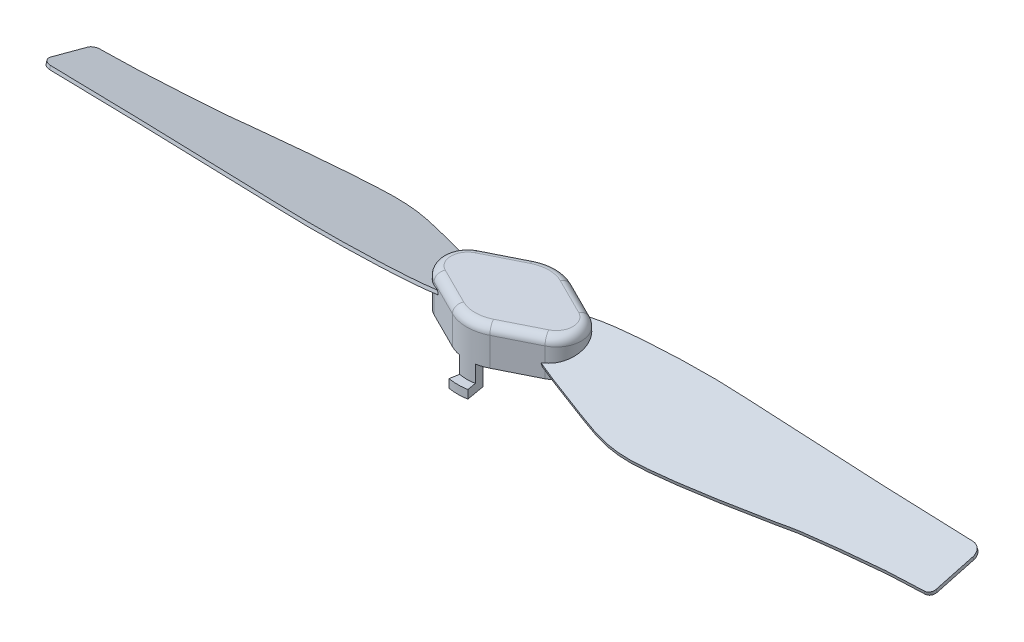
from build123d import *

# Parameters (mm, degrees)
EXTRUDE_START            = 2
EXTRUDE_1_DEPTH          = 3.2
EXTRUDE_3_DEPTH          = 0.1
PATTERN_CIRCULAR_1_COUNT = 2
SCALE_1_SCALE            = 2
FILLET_4_R               = 3
FILLET_5_R               = 5
FILLET_6_R               = 1
CUT_EXTRUDE_START        = -2
CUT_EXTRUDE_2_DEPTH      = 2
EXTRUDE_4_DEPTH          = 1
SCALE_2_SCALE            = 1.2
SKETCH_11_R              = 1
CUT_EXTRUDE_1_DEPTH      = 10


with BuildPart() as part:
    # 草图1 → 凸台-拉伸1 (new body)
    with BuildSketch(Plane(origin=(0, 0, 0), x_dir=(1, 0, 0), z_dir=(0, 1, 0)).offset(EXTRUDE_START)):
        Polygon((0, 2.9999999999999987), (-6, -8.7e-16), (0, -3.0000000000000013), (6, -8.7e-16), align=None)
    extrude(amount=EXTRUDE_1_DEPTH)

    # 草图9 → 凸台-拉伸3 (add, symmetric)
    with BuildSketch(Plane(origin=(0, 3.797877056362574, 1.0176380902050437), x_dir=(1, 0, 0), z_dir=(0, -0.9659258262890681, -0.25881904510252135))):
        with BuildLine():
            Line((-26.704099966580973, 0.3228041612460983), (-26.704099966580973, -1.9456761450061155))
            ThreePointArc((-26.704099966580973, -1.9456761450061155), (-26.533870316829233, -2.3867624553547033), (-26.111452674601363, -2.5991267705448466))
            add(Edge.make_bspline(
                [(-26.111452674601363, -2.5991267705448466), (-22.91052955721552, -2.689038243060296), (-24.11600085649285, -2.647838483964524), (-17.55233762123022, -2.8675340095287067), (-13.329663826254631, -3.0646436883019175), (-9.295103789130488, -3.2316401812276747), (-3.3382956120395084, -3.0618584532998), (-1.3944307323966896, -1.9667682940381868), (2.5093571682922495, 0.10610292246982139), (-1.4328853293939272, -0.5176380902050427)],
                knots=[0, 0, 0, 0, 0.21391373935722907, 0.26957603752511283, 0.5247288767728682, 0.5822784270431667, 0.7875219899577989, 0.8184556881986614, 1, 1, 1, 1], degree=3))
            add(Edge.make_bspline(
                [(-1.4328853293939272, -0.5176380902050427), (-2.7254157371995125, 0.27488564280840305), (-2.9583478396869727, 0.3643261996773897), (-7.694909114548022, 1.9383194941570494), (-9.152331340020703, 2.4326101573356893), (-12.990392513685167, 2.1706227424022266), (-15.907183554042758, 1.747793942402001), (-19.098378261811416, 1.2660471225422296), (-18.80374303384359, 1.197314804012044), (-24.763605801949996, 0.7054991365312095), (-25.80195775381894, 0.7263718807801985), (-26.339263844723146, 0.6876014087170593)],
                knots=[0, 0, 0, 0, 0.27318993124150337, 0.32414467973247946, 0.4889471732233965, 0.5311525810637701, 0.7039933502958418, 0.7485062511039996, 0.9317686883371911, 0.9592088436922059, 1, 1, 1, 1], degree=3))
            ThreePointArc((-26.339263844723146, 0.6876014087170593), (-26.597239582143125, 0.5807685132284266), (-26.704099966580973, 0.3228041612460983))
        make_face()
    extrude(amount=EXTRUDE_3_DEPTH, both=True)

    # 阵列(圆周)1: part ×2 about axis
    pattern_circular_1_axis = Axis((0, 4.339942807531289, 0), (0, -1, 0))


with BuildPart() as part_1:
    add(part.part)
    for i in range(1, PATTERN_CIRCULAR_1_COUNT):
        add(part.part.rotate(pattern_circular_1_axis, i * 360 / PATTERN_CIRCULAR_1_COUNT))


with BuildPart() as part_2:
    # 缩放比例1: scaled about (0, 0, 0)
    add(part_1.part.scale(SCALE_1_SCALE))

    # 圆角4
    fillet_4_edges = [part_2.edges().sort_by_distance(p)[0] for p in [
        (-12, 9.374079978861174, 1.73e-15),
        (12, 9.374079978861174, 1.73e-15),
        (-12, 5.967024742779158, 1.73e-15),
        (12, 5.967024742779158, 1.73e-15),
    ]]
    fillet(fillet_4_edges, radius=FILLET_4_R)

    # 圆角5
    fillet_5_edges = [part_2.edges().sort_by_distance(p)[0] for p in [
        (0, 7.2, 6.000000000000003),
        (0, 7.2, -5.999999999999997),
    ]]
    fillet(fillet_5_edges, radius=FILLET_5_R)

    # 圆角6
    fillet_6_edges = [part_2.edges().sort_by_distance(p)[0] for p in [
        (-8.29179606750063, 10.4, 2.93e-15),
        (-4.434752415750148, 10.4, -3.7826237921249235),
        (-5.05e-15, 10.4, -5.409830056250526),
        (4.434752415750145, 10.4, -3.7826237921249253),
        (8.29179606750063, 10.4, 4.6e-16),
        (4.434752415750148, 10.4, 3.782623792124929),
        (-1.72e-15, 10.4, 5.409830056250529),
        (-4.434752415750147, 10.4, 3.782623792124929),
    ]]
    fillet(fillet_6_edges, radius=FILLET_6_R)

    # 草图15 → 切除-拉伸2 (cut)
    with BuildSketch(Plane.XZ.offset(-4).offset(CUT_EXTRUDE_START)):
        with BuildLine():
            ThreePointArc((-2.2360679774997916, -4.881966011250103), (-1.6022624606124998, -5.1461529978701055), (-0.9382380047215096, -5.321012138651479))
            Line((-0.9382380047215095, -5.32101213865148), (-0.746687163967802, -4.2346733379524935))
            ThreePointArc((-0.746687163967823, -4.234673337952491), (-1.607e-14, -4.3), (0.746687163967795, -4.234673337952495))
            Line((0.7466871639677719, -4.234673337952499), (0.9382380047214718, -5.321012138651487))
            ThreePointArc((0.9382380047214719, -5.321012138651488), (1.602262460612478, -5.146152997870114), (2.236067977499784, -4.881966011250107))
            Line((2.236067977499784, -4.881966011250106), (6.633436854000504, -2.6832815729997463))
            ThreePointArc((6.633436854000504, -2.683281572999746), (8.29179606750063, 2.11e-15), (6.633436854000504, 2.6832815729997503))
            Line((6.633436854000504, 2.6832815729997503), (2.23606797749979, 4.881966011250108))
            ThreePointArc((2.2360679774997902, 4.881966011250109), (1.6022624606124998, 5.146152997870111), (0.938238004721511, 5.321012138651485))
            Line((0.9382380047215104, 5.321012138651485), (0.7466871639678019, 4.234673337952493))
            ThreePointArc((0.7466871639678262, 4.23467333795249), (1.554e-14, 4.3), (-0.7466871639677947, 4.234673337952496))
            Line((-0.7466871639677716, 4.234673337952499), (-0.9382380047214723, 5.321012138651493))
            ThreePointArc((-0.938238004721473, 5.321012138651492), (-1.6022624606124816, 5.146152997870118), (-2.2360679774997916, 4.881966011250107))
            Line((-2.236067977499792, 4.881966011250106), (-6.633436854000504, 2.6832815729997503))
            ThreePointArc((-6.633436854000504, 2.6832815729997503), (-8.29179606750063, 2.33e-15), (-6.633436854000505, -2.683281572999746))
            Line((-6.633436854000505, -2.6832815729997455), (-2.2360679774997907, -4.881966011250102))
        make_face()
    extrude(amount=CUT_EXTRUDE_2_DEPTH, mode=Mode.SUBTRACT)

    # 草图17 → 凸台-拉伸4 (add)
    with BuildSketch(Plane.XZ.offset(-4)):
        with BuildLine():
            ThreePointArc((1.1287131548350022, 6.40125039457936), (-1.05e-15, 6.5), (-1.1287131548350045, 6.40125039457936))
            Line((-1.128713154835004, 6.4012503945793595), (-0.7466871639677719, 4.234673337952501))
            ThreePointArc((-0.746687163967772, 4.234673337952501), (1.54e-14, 4.300000000000001), (0.7466871639678024, 4.234673337952494))
            Line((0.7466871639678023, 4.234673337952494), (1.128713154835003, 6.401250394579361))
        make_face()
        with BuildLine():
            ThreePointArc((-1.1287131548350018, -6.40125039457936), (-1.19e-15, -6.5), (1.1287131548349993, -6.40125039457936))
            Line((1.1287131548350042, -6.4012503945793595), (0.7466871639677721, -4.2346733379525))
            ThreePointArc((0.7466871639677721, -4.2346733379525), (-1.527e-14, -4.300000000000001), (-0.7466871639678021, -4.234673337952494))
            Line((-0.7466871639678021, -4.234673337952494), (-1.1287131548350022, -6.401250394579361))
        make_face()
    extrude(amount=EXTRUDE_4_DEPTH)


with BuildPart() as part_3:
    # 缩放比例2: scaled about (0, 8.019284702, 0)
    add(part_2.part.scale(SCALE_2_SCALE).moved(Location((0, -1.6038569403999996, 0))))

    # 草图11 → 切除-拉伸1 (cut)
    with BuildSketch(Plane.XZ):
        Circle(SKETCH_11_R)
    extrude(amount=-CUT_EXTRUDE_1_DEPTH, mode=Mode.SUBTRACT)


with BuildPart() as body_2:
    # 镜向1: mirrored copy
    add(part_3.part.mirror(Plane.XY.offset(10)))


solid = body_2.part
